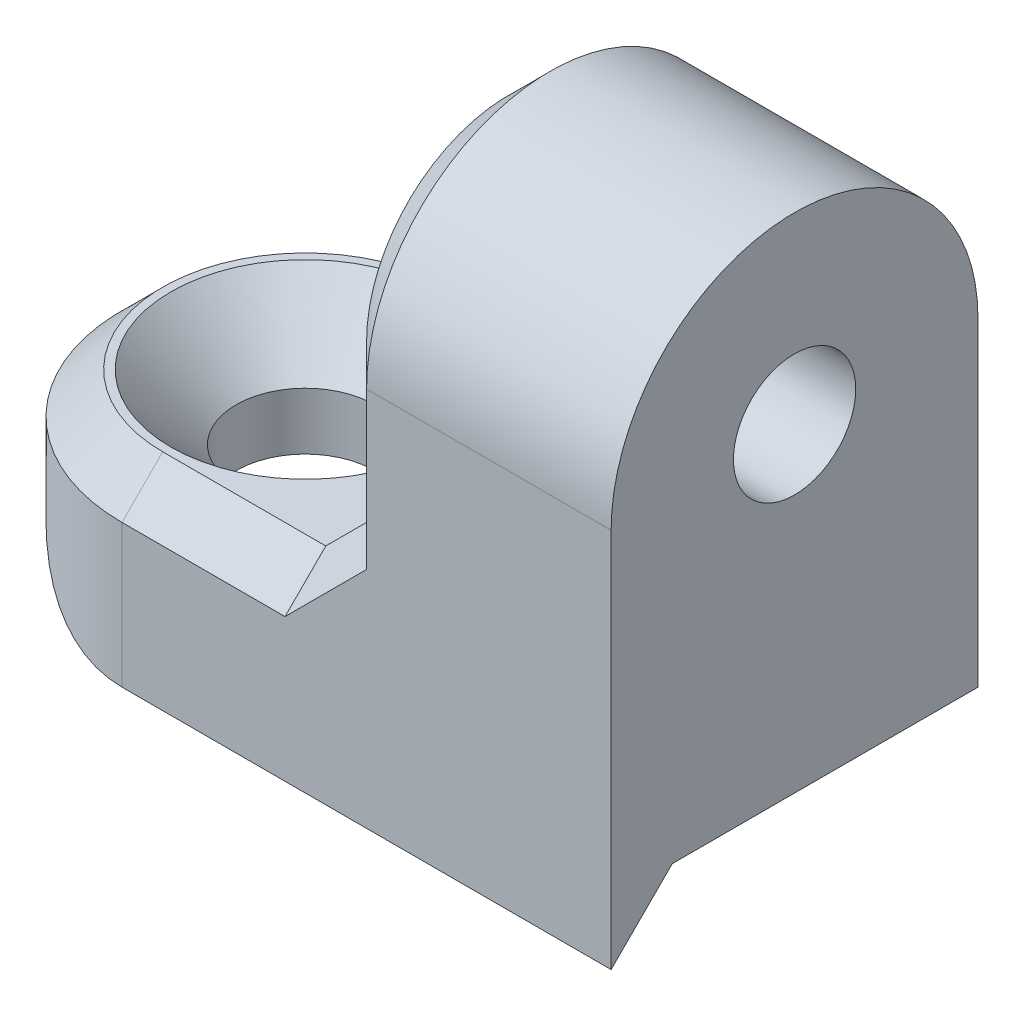
from build123d import *

# Parameters (mm, degrees)
SKETCH_1_R                = 1.5
EXTRUDE_1_DEPTH           = 3
SKETCH_3_R                = 1.5
EXTRUDE_2_DEPTH           = 7
EXTRUDE_START             = -15.354101966
EXTRUDE_3_DEPTH           = 15.354101966
EXTRUDE_START_2           = -2
EXTRUDE_3_2_DEPTH         = 2
HOLE_WIZARD_1_D           = 3.4
HOLE_WIZARD_1_CSINK_D     = 6.6
HOLE_WIZARD_1_CSINK_ANGLE = 90
CHAMFER_1_SIZE            = 1


with BuildPart() as part:
    # 草图1 → 凸台-拉伸1 (new body)
    with BuildSketch(Plane(origin=(0, 0, 0), x_dir=(1, 0, 0), z_dir=(0, 1, 0))):
        with BuildLine():
            Line((0, 4.5), (12, 4.5))
            Line((12, 4.5), (12, -4.5))
            Line((12, -4.5), (0, -4.5))
            ThreePointArc((0, -4.5), (-4.5, 0), (0, 4.5))
        make_face()
        with Locations(Location((0, 0, 0), (0, 0, 270))):
            Circle(SKETCH_1_R, mode=Mode.SUBTRACT)
    extrude(amount=EXTRUDE_1_DEPTH)

    # 草图3 → 凸台-拉伸2 (add)
    with BuildSketch(Plane(origin=(12, 0, 0), x_dir=(0, 0, -1), z_dir=(1, 0, 0))):
        with BuildLine():
            Line((-4.5, 7.834100358), (-4.5, 0))
            Line((-4.5, 0), (4.5, 0))
            Line((4.5, 0), (4.5, 7.834100358))
            ThreePointArc((4.5, 7.834100358), (0, 12.334100358), (-4.5, 7.834100358))
        make_face()
        with Locations((0, 7.834100358)):
            Circle(SKETCH_3_R, mode=Mode.SUBTRACT)
    extrude(amount=-EXTRUDE_2_DEPTH)

    # 凸台-拉伸3: read off the stored shape, not the designer's step
    # 凸台-拉伸3 outline → 凸台-拉伸3 (add)
    with BuildSketch(Plane(origin=(12, 0, 0), x_dir=(0, 0, -1), z_dir=(1, 0, 0)).offset(EXTRUDE_START)):
        Polygon((-4.5, 0), (-4.5, -1.5), (-3, 0), align=None)
    extrude(amount=EXTRUDE_3_DEPTH)

    # Extrude 3 2 outline → Extrude 3 2 (cut)
    with BuildSketch(Plane(origin=(0, 0, 0), x_dir=(1, 0, 0), z_dir=(0, 1, 0)).offset(EXTRUDE_START_2)):
        with BuildLine():
            Line((-3.354101966, -4.5), (0, -4.5))
            ThreePointArc((0, -4.5), (-1.837117307, -4.107919181), (-3.354101966, -3))
            Line((-3.354101966, -3), (-3.354101966, -4.5))
        make_face()
    extrude(amount=EXTRUDE_3_2_DEPTH, mode=Mode.SUBTRACT)

    # 打孔尺寸(%根据十字)槽半沉头木螺钉的类型1 (through all)
    with Locations(Plane(origin=(0, 3, 0), x_dir=(1, 0, 0), z_dir=(0, 1, 0))):
        with Locations((0, 0)):
            CounterSinkHole(HOLE_WIZARD_1_D / 2, HOLE_WIZARD_1_CSINK_D / 2, counter_sink_angle=HOLE_WIZARD_1_CSINK_ANGLE)

    # 倒角1
    chamfer_1_edges = [part.edges().sort_by_distance(p)[0] for p in [
        (2.5, 3, -4.5),
        (5, 3, 0),
        (5, 12.334100358, 0),
        (5, 5.417050179, -4.5),
        (5, 5.417050179, 4.5),
        (-4.5, 3, 0),
        (2.5, 3, 4.5),
    ]]
    chamfer(chamfer_1_edges, length=CHAMFER_1_SIZE)


solid = part.part
